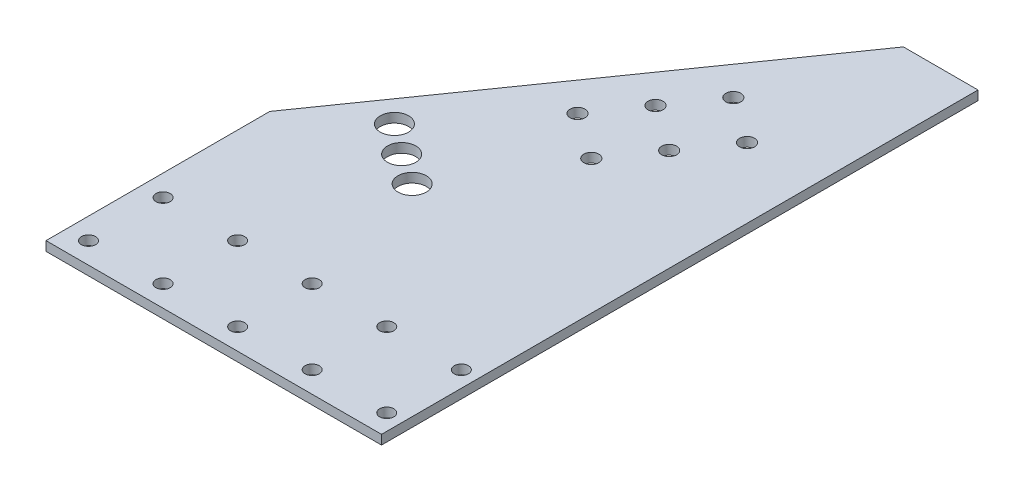
from build123d import *

# Parameters (mm, degrees)
SKETCH1_W           = 114.3
SKETCH1_H           = 203.2
BOSS_EXTRUDE1_DEPTH = 3.175
SKETCH2_R           = 2.413
CUT_EXTRUDE1_DEPTH  = 234.16262699
CUT_EXTRUDE4_DEPTH  = 234.16262699
SKETCH3_R           = 2.5527
CUT_EXTRUDE2_DEPTH  = 234.16262699
SKETCH6_R           = 4.826
CUT_EXTRUDE5_DEPTH  = 234.16262699


with BuildPart() as part:
    # Sketch1 → Boss-Extrude1 (new body)
    with BuildSketch(Plane(origin=(0, 0, 0), x_dir=(1, 0, 0), z_dir=(0, 1, 0))):
        with Locations((57.15, 101.6)):
            Rectangle(SKETCH1_W, SKETCH1_H)
    extrude(amount=BOSS_EXTRUDE1_DEPTH)

    # Sketch2 → Cut-Extrude1 (cut, through all)
    with BuildSketch(Plane(origin=(0, 3.175, 0), x_dir=(1, 0, 0), z_dir=(0, 1, 0))):
        with Locations((7.239, 7.239)):
            Circle(SKETCH2_R)
        with Locations((7.239, 32.639)):
            Circle(SKETCH2_R)
        with Locations((32.639, 32.639)):
            Circle(SKETCH2_R)
        with Locations((58.039, 32.639)):
            Circle(SKETCH2_R)
        with Locations((83.439, 32.639)):
            Circle(SKETCH2_R)
        with Locations((108.839, 32.639)):
            Circle(SKETCH2_R)
        with Locations((32.639, 7.239)):
            Circle(SKETCH2_R)
        with Locations((58.039, 7.239)):
            Circle(SKETCH2_R)
        with Locations((83.439, 7.239)):
            Circle(SKETCH2_R)
        with Locations((108.839, 7.239)):
            Circle(SKETCH2_R)
    extrude(amount=-CUT_EXTRUDE1_DEPTH, mode=Mode.SUBTRACT)

    # Sketch5 → Cut-Extrude4 (cut, through all)
    with BuildSketch(Plane(origin=(0, 0, 0), x_dir=(-1, 0, 0), z_dir=(0, -1, 0))):
        Polygon((-88.9, 203.2), (0, 76.237642201), (0, 203.2), align=None)
    extrude(amount=-CUT_EXTRUDE4_DEPTH, mode=Mode.SUBTRACT)

    # Sketch3 → Cut-Extrude2 (cut, through all)
    with BuildSketch(Plane(origin=(0, 3.175, 0), x_dir=(1, 0, 0), z_dir=(0, 1, 0))):
        with Locations((90.481040709, 148.343758146)):
            Circle(SKETCH3_R)
        with Locations((74.876194266, 159.270389258)):
            Circle(SKETCH3_R)
        with Locations((63.949563153, 143.665542814)):
            Circle(SKETCH3_R)
        with Locations((79.554409597, 132.738911702)):
            Circle(SKETCH3_R)
        with Locations((68.627778484, 117.134065258)):
            Circle(SKETCH3_R)
        with Locations((53.022932041, 128.060696371)):
            Circle(SKETCH3_R)
    extrude(amount=-CUT_EXTRUDE2_DEPTH, mode=Mode.SUBTRACT)

    # Sketch6 → Cut-Extrude5 (cut, through all)
    with BuildSketch(Plane(origin=(0, 3.175, 0), x_dir=(1, 0, 0), z_dir=(0, 1, 0))):
        with Locations((24.926651696, 93.77679445)):
            Circle(SKETCH6_R)
        with Locations((35.048356715, 86.106)):
            Circle(SKETCH6_R)
        with Locations((45.638587952, 79.096220948)):
            Circle(SKETCH6_R)
    extrude(amount=-CUT_EXTRUDE5_DEPTH, mode=Mode.SUBTRACT)


solid = part.part
